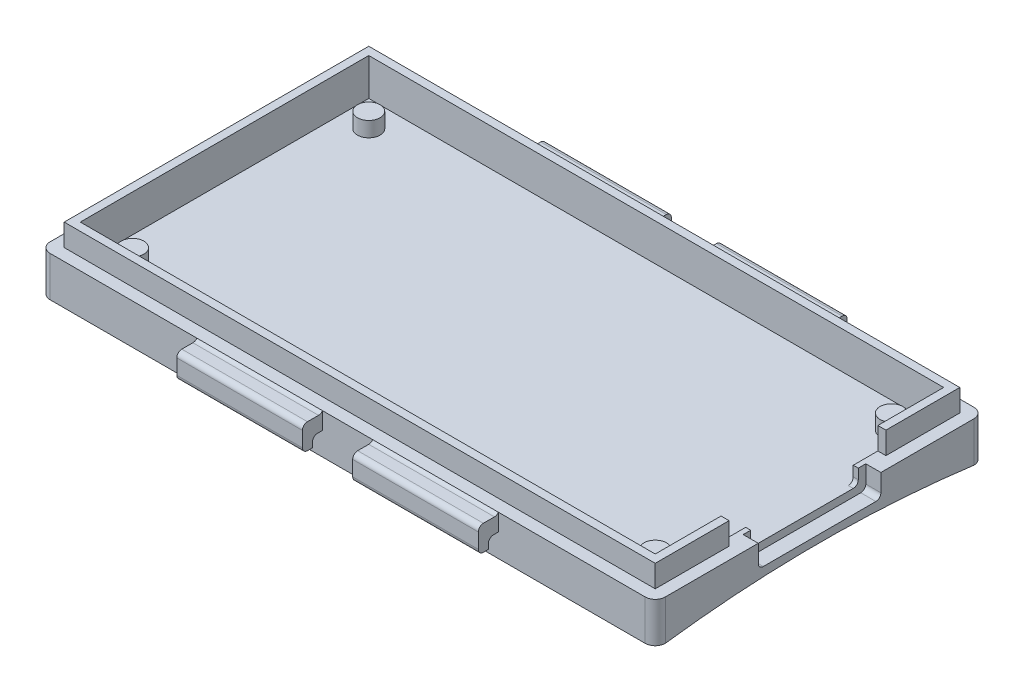
from build123d import *

# Parameters (mm, degrees)
SKETCH2_W               = 61.2
SKETCH2_H               = 32.7
BOSS_EXTRUDE1_DEPTH     = 1.5
BOSS_EXTRUDE2_START     = 1.5
SKETCH2_3_R             = 1.125
BOSS_EXTRUDE2_DEPTH     = 1.5
SKETCH2_7_W             = 61.2
SKETCH2_7_H             = 32.7
BOSS_EXTRUDE5_DEPTH     = 1
FILLET1_R               = 1
CUT_EXTRUDE2_DEPTH      = 35.823591142
CUT_EXTRUDE2_DEPTH_BACK = 0.75
CUT_EXTRUDE2_START      = 1.5
SKETCH2_5_W             = 1.5
SKETCH2_5_H             = 0.75
SKETCH2_5_H_2           = 10.7
FILLET3_R               = 0.5
BOSS_EXTRUDE4_DEPTH     = 2.2
BOSS_EXTRUDE6_DEPTH     = 15
CUT_EXTRUDE4_DEPTH      = 2.5
FILLET4_R               = 0.5
FILLET4_OF_MIRROR1_R    = 0.5
FILLET5_R               = 0.5
CUT_EXTRUDE5_DEPTH      = 37.057211484
CUT_EXTRUDE5_DEPTH_BACK = 37.057211484


with BuildPart() as part:
    # Sketch2 → Boss-Extrude1 (new body)
    with BuildSketch(Plane(origin=(0, 0, 0), x_dir=(1, 0, 0), z_dir=(0, 1, 0))):
        Rectangle(SKETCH2_W, SKETCH2_H)
    extrude(amount=BOSS_EXTRUDE1_DEPTH)

    # Sketch2<3> → Boss-Extrude2 (add)
    with BuildSketch(Plane(origin=(0, 0, 0), x_dir=(1, 0, 0), z_dir=(0, 1, 0)).offset(BOSS_EXTRUDE2_START)):
        Polygon((-30.6, 16.35), (-30.6, -16.35), (30.6, -16.35), (30.6, -6.1), (29.1, -6.1), (29.1, -5.35), (28.6, -5.35), (28.6, -14.35), (-28.6, -14.35), (-28.6, 14.35), (28.6, 14.35), (28.6, 5.35), (30.6, 5.35), (30.6, 16.35), align=None)
        with Locations(Location((-26, 11.75, 0), (0, 0, 270))):
            Circle(SKETCH2_3_R)
        with Locations(Location((-26, -11.75, 0), (0, 0, 270))):
            Circle(SKETCH2_3_R)
        with Locations(Location((26, -11.75, 0), (0, 0, 270))):
            Circle(SKETCH2_3_R)
        with Locations(Location((26, 11.75, 0), (0, 0, 270))):
            Circle(SKETCH2_3_R)
    extrude(amount=BOSS_EXTRUDE2_DEPTH)

    # Sketch2<7> → Boss-Extrude5 (add)
    with BuildSketch(Plane(origin=(0, 0, 0), x_dir=(1, 0, 0), z_dir=(0, 1, 0))):
        Rectangle(SKETCH2_7_W, SKETCH2_7_H)
    extrude(amount=-BOSS_EXTRUDE5_DEPTH)

    # Fillet1
    fillet1_edges = [part.edges().sort_by_distance(p)[0] for p in [
        (-30.6, 1, -16.35),
        (30.6, 1, -16.35),
        (30.6, 1, 16.35),
        (-30.6, 1, 16.35),
    ]]
    fillet(fillet1_edges, radius=FILLET1_R)

    # Sketch2<5> → Cut-Extrude2 (cut, two sides: drawn at the far end of the back side and taken through both)
    with BuildSketch(Plane(origin=(0, 0, 0), x_dir=(1, 0, 0), z_dir=(0, 1, 0)).offset(CUT_EXTRUDE2_START - CUT_EXTRUDE2_DEPTH_BACK)):
        with Locations((29.85, 5.725)):
            Rectangle(SKETCH2_5_W, SKETCH2_5_H)
        with Locations((29.85, 0)):
            Rectangle(SKETCH2_5_W, SKETCH2_5_H_2)
        with Locations((29.85, -5.725)):
            Rectangle(SKETCH2_5_W, SKETCH2_5_H)
    extrude(amount=CUT_EXTRUDE2_DEPTH + CUT_EXTRUDE2_DEPTH_BACK, mode=Mode.SUBTRACT)

    # Fillet3
    fillet3_edges = [part.edges().sort_by_distance(p)[0] for p in [
        (29.85, 0.75, 6.1),
        (29.85, 0.75, -6.1),
        (28.85, 1.5, -5.35),
        (28.85, 1.5, 5.35),
    ]]
    fillet(fillet3_edges, radius=FILLET3_R)

    # Sketch4 → Boss-Extrude4 (add)
    with BuildSketch(Plane(origin=(0, 3, 0), x_dir=(1, 0, 0), z_dir=(0, 1, 0))):
        Polygon((29.4, 15.15), (-29.4, 15.15), (-29.4, -15.15), (29.4, -15.15), (29.4, -7.8), (28.6, -7.8), (28.6, -14.35), (-28.6, -14.35), (-28.6, 14.35), (28.6, 14.35), (28.6, 7.8), (29.4, 7.8), align=None)
    extrude(amount=BOSS_EXTRUDE4_DEPTH)

    # Sketch5 → Boss-Extrude6 (add, symmetric)
    with BuildSketch(Plane(origin=(0, 0, 0), x_dir=(0, 0, -1), z_dir=(1, 0, 0))):
        Polygon((-16.35, 2.8), (-18.35, 2.8), (-18.35, 0.3), (-17.35, 0.3), (-17.35, 1.3), (-16.35, 1.3), align=None)
    boss_extrude6 = extrude(amount=BOSS_EXTRUDE6_DEPTH, both=True)

    # Sketch5<3> → Cut-Extrude4 (cut, symmetric)
    with BuildSketch(Plane(origin=(0, 0, 0), x_dir=(0, 0, -1), z_dir=(1, 0, 0))):
        Polygon((-16.35, 2.8), (-18.35, 2.8), (-18.35, 0.3), (-17.35, 0.3), (-17.35, 1.3), (-16.35, 1.3), align=None)
    cut_extrude4 = extrude(amount=CUT_EXTRUDE4_DEPTH, both=True, mode=Mode.SUBTRACT)

    # Fillet4
    fillet4_edges = [part.edges().sort_by_distance(p)[0] for p in [
        (8.75, 1.3, 17.35),
        (8.75, 2.8, 18.35),
        (8.75, 0.3, 18.35),
        (-8.75, 0.3, 18.35),
        (-8.75, 2.8, 18.35),
        (-8.75, 1.3, 17.35),
    ]]
    fillet(fillet4_edges, radius=FILLET4_R)

    # Mirror1: Boss-Extrude6, Cut-Extrude4 across plane
    add(boss_extrude6.mirror(Plane.XY))
    add(cut_extrude4.mirror(Plane.XY), mode=Mode.SUBTRACT)

    # Fillet4 of Mirror1
    fillet4_of_mirror1_edges = [part.edges().sort_by_distance(p)[0] for p in [
        (8.75, 1.3, -17.35),
        (8.75, 2.8, -18.35),
        (8.75, 0.3, -18.35),
        (-8.75, 0.3, -18.35),
        (-8.75, 2.8, -18.35),
        (-8.75, 1.3, -17.35),
    ]]
    fillet(fillet4_of_mirror1_edges, radius=FILLET4_OF_MIRROR1_R)

    # Fillet5
    # the kernel refuses this fillet: 0.5 mm, written as the material it adds along each edge
    with BuildSketch(Plane(origin=(15, 2.8, 16.35), x_dir=(0, 1.0, 2.6076918401885707e-11), z_dir=(-1, 0, 0)), Plane(origin=(-2.5, 2.8, 16.35), x_dir=(0, 1.0, 2.6076918401885707e-11), z_dir=(-1, 0, 0))) as fillet5_piece_1:
        with BuildLine():
            CenterArc((0.5, -0.4), FILLET5_R, 126.869897647, 53.130102355)
            Line((0, -0.4), (-0.01, -0.4))
            Line((-0.01, -0.4), (-0.01, 0))
            Line((-0.01, 0), (0, 0.01))
            ThreePointArc((0, 0.01), (0.1, 0.01), (0.194, 0.008))
            Line((0.194, 0.008), (0.2, 0))
        make_face()
    extrude(amount=12.5)
    with BuildSketch(Plane(origin=(15, 2.8, -16.35), x_dir=(0, 0, -1), z_dir=(-1, 0, 0))) as fillet5_piece_2:
        with BuildLine():
            CenterArc((0.4, -0.5), FILLET5_R, 90, 53.130102355)
            Line((0, -0.2), (-0.008, -0.194))
            ThreePointArc((-0.008, -0.194), (-0.01, -0.1), (-0.01, 0))
            Line((-0.01, 0), (0, 0.01))
            Line((0, 0.01), (0.4, 0.01))
            Line((0.4, 0.01), (0.4, 0))
        make_face()
    extrude(amount=12.5)
    with BuildSketch(Plane(origin=(-2.5, 2.8, -16.35), x_dir=(0, 1.0, -2.6112445538673017e-11), z_dir=(-1, 0, 0))) as fillet5_piece_3:
        with BuildLine():
            CenterArc((0.5, 0.4), FILLET5_R, 179.999999999, 53.130102355)
            Line((0, 0.4), (-0.01, 0.4))
            Line((-0.01, 0.4), (-0.01, 0))
            Line((-0.01, 0), (0, -0.01))
            ThreePointArc((0, -0.01), (0.1, -0.01), (0.194, -0.008))
            Line((0.194, -0.008), (0.2, 0))
        make_face()
    extrude(amount=12.5)

    # Sketch6 → Cut-Extrude5 (cut, two sides: drawn at the far end of the back side and taken through both)
    with BuildSketch(Plane(origin=(0, 0, 0), x_dir=(0, 0, -1), z_dir=(1, 0, 0)).offset(-CUT_EXTRUDE5_DEPTH_BACK)):
        with BuildLine():
            Line((-15.35, -1), (15.35, -1))
            ThreePointArc((15.35, -1), (0, 0), (-15.35, -1))
        make_face()
    extrude(amount=CUT_EXTRUDE5_DEPTH + CUT_EXTRUDE5_DEPTH_BACK, mode=Mode.SUBTRACT)


solid = part.part
